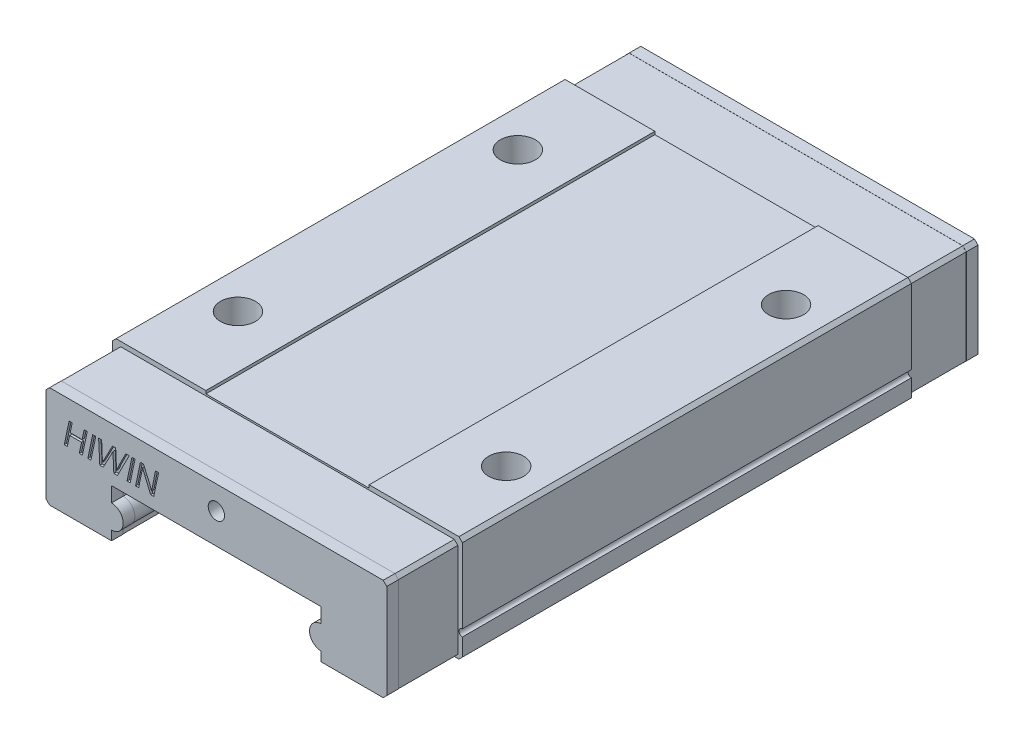
from build123d import *

# Parameters (mm, degrees)
ESBO_O1_W                        = 30
ESBO_O1_H                        = 38.5
RESSALTO_EXTRUS_O1_DEPTH         = 9.1
ESBO_O2_W                        = 14
ESBO_O2_H                        = 0.25
CORTE_EXTRUS_O1_DEPTH            = 44.026154836
ESBO_O3_W                        = 29.2
ESBO_O3_H                        = 8.7
RESSALTO_EXTRUS_O2_DEPTH         = 6.1
ESBO_O4_W                        = 29.2
ESBO_O4_H                        = 8.7
RESSALTO_EXTRUS_O3_DEPTH         = 6.1
CORTE_EXTRUS_O2_DEPTH            = 55.217063735
CORTE_EXTRUS_O3_DEPTH            = 0.2
RESSALTO_EXTRUS_O4_DEPTH         = 0.2
CORTE_EXTRUS_O4_DEPTH            = 0.2
CORTE_EXTRUS_O5_DEPTH            = 0.2
CORTE_EXTRUS_O6_DEPTH            = 0.2
CORTE_EXTRUS_O7_DEPTH            = 0.2
CORTE_EXTRUS_O8_DEPTH            = 0.2
CORTE_EXTRUS_O9_DEPTH            = 0.2
CORTE_EXTRUS_O10_DEPTH           = 0.2
ESBO_O15_W                       = 0.265487361
ESBO_O15_H                       = 1.969960833
CORTE_EXTRUS_O11_DEPTH           = 0.2
ESBO_O16_W                       = 0.266231022
ESBO_O16_H                       = 1.969960833
CORTE_EXTRUS_O12_DEPTH           = 0.2
INCLINA_O1_ANGLE                 = 22.633115591
INCLINA_O2_ANGLE                 = 11.39188109
INCLINA_O3_ANGLE                 = -3.046843479
INCLINA_O4_ANGLE                 = 28.192334499
INCLINA_O5_ANGLE                 = -11.990834979
INCLINA_O6_ANGLE                 = 12.079016479
INCLINA_O7_ANGLE                 = 11.88865804
INCLINA_O8_ANGLE                 = -11.938434882
INCLINA_O9_ANGLE                 = 11.978014058
INCLINA_O10_ANGLE                = -11.998710083
INCLINA_O11_ANGLE                = 11.998710083
INCLINA_O12_ANGLE                = -11.978014058
INCLINA_O13_ANGLE                = 14.581196285
INCLINA_O14_ANGLE                = 14.573026217
INCLINA_O15_ANGLE                = 14.976582162
INCLINA_O16_ANGLE                = -14.766991465
FURO_DE_DI_METRO_1_4_1_4_1_D     = 1.4
FURO_DE_DI_METRO_1_4_1_4_1_DEPTH = 5
FURO_DE_DI_METRO_1_4_1_4_1_TIP   = 0.420602433
FURO_DE_DI_METRO_1_4_1_4_2_D     = 1.4
FURO_DE_DI_METRO_1_4_1_4_2_DEPTH = 5
FURO_DE_DI_METRO_1_4_1_4_2_TIP   = 0.420602433
FURO_DE_DI_METRO_0_6_0_6_1_D     = 0.6
FURO_DE_DI_METRO_3_0_3_1_D       = 3
FURO_DE_DI_METRO_3_0_3_1_DEPTH   = 3
FURO_DE_DI_METRO_3_0_3_1_TIP     = 0.901290929
CHANFRO1_SIZE                    = 0.3
FILETE7_R                        = 0.4
RESSALTO_EXTRUS_O8_START         = -1
RESSALTO_EXTRUS_O8_DEPTH         = 1
RESSALTO_EXTRUS_O9_DEPTH         = 1


with BuildPart() as part:
    # Esboço1 → Ressalto-extrusão1 (new body)
    with BuildSketch(Plane.XZ.offset(-2.9)):
        Rectangle(ESBO_O1_W, ESBO_O1_H)
    extrude(amount=-RESSALTO_EXTRUS_O1_DEPTH)

    # Esboço2 → Corte-extrusão1 (cut, through all)
    with BuildSketch(Plane.XY.offset(19.25)):
        with Locations((0, 11.875)):
            Rectangle(ESBO_O2_W, ESBO_O2_H)
    extrude(amount=-CORTE_EXTRUS_O1_DEPTH, mode=Mode.SUBTRACT)

    # Esboço3 → Ressalto-extrusão2 (add)
    with BuildSketch(Plane(origin=(0, 0, -19.25), x_dir=(-1, 0, 0), z_dir=(0, 0, -1))):
        with Locations((0, 7.25)):
            Rectangle(ESBO_O3_W, ESBO_O3_H)
    extrude(amount=RESSALTO_EXTRUS_O2_DEPTH)

    # Esboço4 → Ressalto-extrusão3 (add)
    with BuildSketch(Plane.XY.offset(19.25)):
        with Locations((0, 7.25)):
            Rectangle(ESBO_O4_W, ESBO_O4_H)
    extrude(amount=RESSALTO_EXTRUS_O3_DEPTH)

    # Esboço5 → Corte-extrusão2 (cut, through all)
    with BuildSketch(Plane.XY.offset(25.35)):
        with BuildLine():
            Line((-9, 2.9), (9, 2.9))
            Line((9, 2.9), (9, 3.7))
            ThreePointArc((9, 3.7), (8, 4.7), (9, 5.7))
            Line((9, 5.7), (9, 7))
            Line((9, 7), (-9, 7))
            Line((-9, 7), (-9, 5.7))
            ThreePointArc((-9, 5.7), (-8, 4.7), (-9, 3.7))
            Line((-9, 3.7), (-9, 2.9))
        make_face()
    extrude(amount=-CORTE_EXTRUS_O2_DEPTH, mode=Mode.SUBTRACT)

    # Esboço6 → Corte-extrusão3 (cut)
    with BuildSketch(Plane(origin=(0, 0, -25.35), x_dir=(-1, 0, 0), z_dir=(0, 0, -1))):
        with BuildLine():
            Line((-7.000151057, 8.44592145), (-7.223791541, 8.430287009))
            add(Edge.make_bspline(
                [(-7.223791541, 8.430287009), (-7.219191725, 8.393318118), (-7.212226655, 8.356510491), (-7.202206849, 8.320629288), (-7.193800871, 8.290527247), (-7.183181512, 8.260912583), (-7.170013247, 8.232568445), (-7.147718227, 8.18457935), (-7.117218551, 8.139342953), (-7.079736622, 8.101991564), (-7.07506839, 8.097339591), (-7.070289483, 8.092796103), (-7.065407855, 8.08836858)],
                knots=[0, 0, 0, 0, 0.000111762, 0.000111762, 0.000111762, 0.000205525, 0.000205525, 0.000205525, 0.000366021, 0.000366021, 0.000366021, 0.000385685, 0.000385685, 0.000385685, 0.000385685], degree=3))
            add(Edge.make_bspline(
                [(-7.065407855, 8.08836858), (-7.028943113, 8.05444789), (-6.985806792, 8.026618159), (-6.939897636, 8.007314273), (-6.894147926, 7.98807743), (-6.844748245, 7.976611018), (-6.795383973, 7.971486488), (-6.720882508, 7.963752452), (-6.643804091, 7.968084429), (-6.571173161, 7.986388298), (-6.504550999, 8.003177884), (-6.440026852, 8.033674479), (-6.384969789, 8.074773414)],
                knots=[0, 0, 0, 0, 0.000149408, 0.000149408, 0.000149408, 0.000297792, 0.000297792, 0.000297792, 0.000522794, 0.000522794, 0.000522794, 0.000729804, 0.000729804, 0.000729804, 0.000729804], degree=3))
            add(Edge.make_bspline(
                [(-6.384969789, 8.074773414), (-6.355205185, 8.096420398), (-6.327621104, 8.121374536), (-6.302932028, 8.148668731), (-6.28049909, 8.173468729), (-6.260251341, 8.200377723), (-6.242270606, 8.228572931), (-6.210688579, 8.278096034), (-6.185721823, 8.332104671), (-6.166087613, 8.387462236)],
                knots=[0, 0, 0, 0, 0.000110412, 0.000110412, 0.000110412, 0.00021058, 0.00021058, 0.00021058, 0.000387215, 0.000387215, 0.000387215, 0.000387215], degree=3))
            add(Edge.make_bspline(
                [(-6.166087613, 8.387462236), (-6.120735052, 8.511715828), (-6.104424369, 8.646152253), (-6.096988169, 8.778214787), (-6.088848603, 8.922768706), (-6.089477381, 9.068822316), (-6.107918975, 9.212425921), (-6.118793707, 9.29710681), (-6.136761323, 9.382507641), (-6.171283235, 9.460593172), (-6.199041917, 9.523380871), (-6.236132155, 9.583322936), (-6.282556522, 9.633895829), (-6.329259846, 9.684772606), (-6.386903718, 9.726949126), (-6.448852587, 9.757477546), (-6.505295364, 9.785292563), (-6.567270431, 9.803747536), (-6.629704565, 9.811585976), (-6.652906702, 9.814498943), (-6.676315223, 9.816039109), (-6.699697885, 9.816314199)],
                knots=[0, 0, 0, 0, 0.000396815, 0.000396815, 0.000396815, 0.000829537, 0.000829537, 0.000829537, 0.001085275, 0.001085275, 0.001085275, 0.00129052, 0.00129052, 0.00129052, 0.001497646, 0.001497646, 0.001497646, 0.001685896, 0.001685896, 0.001685896, 0.001755009, 0.001755009, 0.001755009, 0.001755009], degree=3))
            add(Edge.make_bspline(
                [(-6.699697885, 9.816314199), (-6.762288901, 9.815779233), (-6.825841451, 9.806411956), (-6.885016327, 9.786009617), (-6.94454396, 9.765485654), (-7.000977347, 9.732936593), (-7.048944549, 9.692145422), (-7.092274819, 9.655297486), (-7.130462702, 9.611388484), (-7.160771481, 9.563256783), (-7.194353078, 9.509927699), (-7.218733637, 9.450049261), (-7.233739281, 9.38884023), (-7.254932074, 9.302393407), (-7.259601282, 9.211076374), (-7.251675424, 9.122423295), (-7.245443573, 9.052718196), (-7.229737294, 8.982656566), (-7.201839013, 8.918474615), (-7.178089774, 8.863837825), (-7.144744662, 8.812414098), (-7.104154079, 8.768806647)],
                knots=[0, 0, 0, 0, 0.00018778, 0.00018778, 0.00018778, 0.000377298, 0.000377298, 0.000377298, 0.000547532, 0.000547532, 0.000547532, 0.000736545, 0.000736545, 0.000736545, 0.001004264, 0.001004264, 0.001004264, 0.00121457, 0.00121457, 0.00121457, 0.001393534, 0.001393534, 0.001393534, 0.001393534], degree=3))
            add(Edge.make_bspline(
                [(-7.104154079, 8.768806647), (-7.07888015, 8.741141941), (-7.050906864, 8.715619213), (-7.020527139, 8.693683405), (-6.978268226, 8.663170179), (-6.930257244, 8.639283379), (-6.88024521, 8.624597703), (-6.833599701, 8.610900583), (-6.784339508, 8.604757724), (-6.735725076, 8.604984894), (-6.698436232, 8.605159141), (-6.661147388, 8.605333388), (-6.623858544, 8.605507635), (-6.617999741, 8.605535013), (-6.612140937, 8.60556239), (-6.606282134, 8.605589768)],
                knots=[0, 0, 0, 0, 0.000112414, 0.000112414, 0.000112414, 0.000270113, 0.000270113, 0.000270113, 0.000416688, 0.000416688, 0.000416688, 0.000528023, 0.000528023, 0.000528023, 0.000545516, 0.000545516, 0.000545516, 0.000545516], degree=3))
            add(Edge.make_bspline(
                [(-6.606282134, 8.605589768), (-6.591891073, 8.613757667), (-6.577500011, 8.621925567), (-6.56310895, 8.630093467), (-6.539529834, 8.643476208), (-6.515950718, 8.65685895), (-6.492371601, 8.670241692), (-6.47347319, 8.680967817), (-6.455164235, 8.692827183), (-6.437742508, 8.70581499), (-6.420313542, 8.718808194), (-6.403702988, 8.732988496), (-6.388201036, 8.748229287), (-6.360358039, 8.775603211), (-6.335864761, 8.806785186), (-6.315634441, 8.840181269)],
                knots=[-0.000130736, -0.000130736, -0.000130736, -0.000130736, -8.1186e-05, -8.1186e-05, -8.1186e-05, 0, 0, 0, 6.519e-05, 6.519e-05, 6.519e-05, 0.000130425, 0.000130425, 0.000130425, 0.000248246, 0.000248246, 0.000248246, 0.000248246], degree=3))
            add(Edge.make_bspline(
                [(-6.315634441, 8.840181269), (-6.312042227, 8.788094157), (-6.314629779, 8.73557303), (-6.319595299, 8.683598855), (-6.322132407, 8.657042902), (-6.325599739, 8.630558345), (-6.330016288, 8.604249608), (-6.334455758, 8.577804331), (-6.339860353, 8.55150257), (-6.346223565, 8.525453172)],
                knots=[0, 0, 0, 0, 0.000156633, 0.000156633, 0.000156633, 0.000236517, 0.000236517, 0.000236517, 0.000316819, 0.000316819, 0.000316819, 0.000316819], degree=3))
            add(Edge.make_bspline(
                [(-6.346223565, 8.525453172), (-6.351493253, 8.503014502), (-6.357243085, 8.480677945), (-6.363666213, 8.458541844), (-6.370091459, 8.436398442), (-6.377193164, 8.414427216), (-6.385279743, 8.392835057), (-6.395320538, 8.366024901), (-6.406899221, 8.339645064), (-6.420996979, 8.314728097)],
                knots=[0, 0, 0, 0, 6.9147e-05, 6.9147e-05, 6.9147e-05, 0.000138335, 0.000138335, 0.000138335, 0.000224386, 0.000224386, 0.000224386, 0.000224386], degree=3))
            add(Edge.make_bspline(
                [(-6.420996979, 8.314728097), (-6.427997096, 8.301410801), (-6.435910039, 8.288529598), (-6.444686248, 8.276309526), (-6.453464947, 8.264085986), (-6.463152217, 8.252464964), (-6.473613092, 8.241645974), (-6.493364076, 8.221218838), (-6.516184683, 8.20344964), (-6.540634441, 8.18897281)],
                knots=[0, 0, 0, 0, 4.5135e-05, 4.5135e-05, 4.5135e-05, 9.029e-05, 9.029e-05, 9.029e-05, 0.000176113, 0.000176113, 0.000176113, 0.000176113], degree=3))
            add(Edge.make_bspline(
                [(-6.540634441, 8.18897281), (-6.554704053, 8.180271865), (-6.569523794, 8.172671538), (-6.584830419, 8.166397173), (-6.600139663, 8.160121735), (-6.616034719, 8.155132928), (-6.632170756, 8.151474733), (-6.659551424, 8.145267272), (-6.687942553, 8.14285025), (-6.716012085, 8.143429003)],
                knots=[0, 0, 0, 0, 4.9628e-05, 4.9628e-05, 4.9628e-05, 9.9266e-05, 9.9266e-05, 9.9266e-05, 0.000183894, 0.000183894, 0.000183894, 0.000183894], degree=3))
            add(Edge.make_bspline(
                [(-6.716012085, 8.143429003), (-6.74586282, 8.142891152), (-6.776289873, 8.146453445), (-6.804776565, 8.155390117), (-6.833465022, 8.164390086), (-6.860841789, 8.179286579), (-6.884085717, 8.198358727), (-6.904553743, 8.215153188), (-6.922387151, 8.235619414), (-6.936572159, 8.257975165), (-6.958776521, 8.292969518), (-6.973702306, 8.332683702), (-6.984518098, 8.372691915), (-6.991031902, 8.396786837), (-6.996098244, 8.421292816), (-7.000151057, 8.44592145)],
                knots=[0, 0, 0, 0, 8.9567e-05, 8.9567e-05, 8.9567e-05, 0.00018014, 0.00018014, 0.00018014, 0.000259489, 0.000259489, 0.000259489, 0.000383963, 0.000383963, 0.000383963, 0.000458384, 0.000458384, 0.000458384, 0.000458384], degree=3))
        make_face()
    extrude(amount=-CORTE_EXTRUS_O3_DEPTH, mode=Mode.SUBTRACT)

    # Esboço7 → Ressalto-extrusão4 (add)
    with BuildSketch(Plane(origin=(0, 0, -25.15), x_dir=(-1, 0, 0), z_dir=(0, 0, -1))):
        with BuildLine():
            add(Edge.make_bspline(
                [(-6.429154079, 8.919712991), (-6.445649499, 8.901133938), (-6.464164385, 8.884101169), (-6.484376522, 8.869653), (-6.511453264, 8.850297829), (-6.542241571, 8.835369923), (-6.574179105, 8.826001545), (-6.607657093, 8.8161813), (-6.643057817, 8.812078593), (-6.677945619, 8.812311178)],
                knots=[0, 0, 0, 0, 7.4535e-05, 7.4535e-05, 7.4535e-05, 0.000175135, 0.000175135, 0.000175135, 0.000280366, 0.000280366, 0.000280366, 0.000280366], degree=3))
            add(Edge.make_bspline(
                [(-6.677945619, 8.812311178), (-6.703658085, 8.812145291), (-6.72953306, 8.814136773), (-6.754804126, 8.818883525), (-6.79045191, 8.825579371), (-6.825606492, 8.838186616), (-6.856898719, 8.8565277), (-6.885462268, 8.873269445), (-6.91142463, 8.895069427), (-6.933534743, 8.919712991), (-6.950633932, 8.938771462), (-6.967733122, 8.957829933), (-6.984832311, 8.976888405), (-7.053229067, 9.05312229), (-7.121625824, 9.129356175), (-7.190022581, 9.20559006), (-7.192042787, 9.207841748), (-7.194062994, 9.210093437), (-7.1960832, 9.212345125)],
                knots=[0, 0, 0, 0, 7.7139e-05, 7.7139e-05, 7.7139e-05, 0.000186943, 0.000186943, 0.000186943, 0.000286874, 0.000286874, 0.000286874, 0.000363289, 0.000363289, 0.000363289, 0.000668949, 0.000668949, 0.000668949, 0.000677977, 0.000677977, 0.000677977, 0.000677977], degree=3))
            add(Edge.make_bspline(
                [(-7.1960832, 9.212345125), (-7.176996051, 9.234211957), (-7.157908902, 9.256078788), (-7.138821752, 9.277945619), (-7.103814199, 9.31805136), (-7.068806647, 9.3581571), (-7.033799094, 9.39826284), (-7.016295317, 9.41831571), (-6.998791541, 9.43836858), (-6.981287764, 9.45842145), (-6.963783988, 9.47847432), (-6.946280211, 9.49852719), (-6.928776435, 9.51858006), (-6.911331635, 9.538565366), (-6.892017349, 9.557136422), (-6.870951634, 9.573259982), (-6.84167926, 9.595664865), (-6.808239884, 9.613581139), (-6.773153111, 9.624884637), (-6.740604182, 9.635370547), (-6.706021058, 9.640480646), (-6.671827795, 9.640936556)],
                knots=[-0.000404628, -0.000404628, -0.000404628, -0.000404628, -0.00031795, -0.00031795, -0.00031795, -0.000158975, -0.000158975, -0.000158975, -7.9487e-05, -7.9487e-05, -7.9487e-05, 0, 0, 0, 7.9584e-05, 7.9584e-05, 7.9584e-05, 0.000191135, 0.000191135, 0.000191135, 0.000294284, 0.000294284, 0.000294284, 0.000294284], degree=3))
            add(Edge.make_bspline(
                [(-6.671827795, 9.640936556), (-6.634717837, 9.6404282), (-6.597066459, 9.634663135), (-6.562044874, 9.622379163), (-6.526811841, 9.610021025), (-6.493435775, 9.590542518), (-6.465169585, 9.566147586), (-6.439778845, 9.544234289), (-6.417622806, 9.518128719), (-6.399533698, 9.489885731), (-6.378524113, 9.457082926), (-6.362744341, 9.420567868), (-6.352015251, 9.383120395), (-6.334703247, 9.322696743), (-6.329533376, 9.258469595), (-6.33171, 9.195652515), (-6.333588643, 9.141435134), (-6.341715285, 9.086418333), (-6.360205894, 9.035416852), (-6.375508462, 8.993208745), (-6.398844739, 8.952834537), (-6.429154079, 8.919712991)],
                knots=[0, 0, 0, 0, 0.00011134, 0.00011134, 0.00011134, 0.000223733, 0.000223733, 0.000223733, 0.000324047, 0.000324047, 0.000324047, 0.000440727, 0.000440727, 0.000440727, 0.000629926, 0.000629926, 0.000629926, 0.000793196, 0.000793196, 0.000793196, 0.000928756, 0.000928756, 0.000928756, 0.000928756], degree=3))
        make_face()
    extrude(amount=RESSALTO_EXTRUS_O4_DEPTH)

    # Esboço8 → Corte-extrusão4 (cut)
    with BuildSketch(Plane.XY.offset(25.35)):
        with BuildLine():
            Line((-10.100248038, 8), (-9.704619815, 8))
            Line((-9.704619815, 8), (-9.704619815, 8.029090311))
            add(Edge.make_bspline(
                [(-8.871718292, 9.586231203), (-8.885848206, 9.554067057), (-8.900169593, 9.521985598), (-8.914771239, 9.49003284), (-8.930187987, 9.456296397), (-8.945910564, 9.422695025), (-8.962153982, 9.389348734), (-8.97841324, 9.355969923), (-8.995161603, 9.322808226), (-9.013014086, 9.290253698), (-9.132581023, 9.072219873), (-9.252147959, 8.854186048), (-9.371714895, 8.636152223), (-9.482683202, 8.433798252), (-9.593651508, 8.231444281), (-9.704619815, 8.029090311)],
                knots=[0, 0, 0, 0, 0.000105393, 0.000105393, 0.000105393, 0.000216673, 0.000216673, 0.000216673, 0.000328076, 0.000328076, 0.000328076, 0.001073914, 0.001073914, 0.001073914, 0.001766116, 0.001766116, 0.001766116, 0.001766116], degree=3))
            add(Edge.make_bspline(
                [(-8.792890112, 8), (-8.801892928, 8.200812798), (-8.810895743, 8.401625596), (-8.819898559, 8.602438395), (-8.827252018, 8.766461389), (-8.834605477, 8.930484384), (-8.841958936, 9.094507379), (-8.849313296, 9.258550449), (-8.858143985, 9.422585386), (-8.871718292, 9.586231203)],
                knots=[0, 0, 0, 0, 0.000603044, 0.000603044, 0.000603044, 0.001095607, 0.001095607, 0.001095607, 0.001588291, 0.001588291, 0.001588291, 0.001588291], degree=3))
            Line((-8.792890112, 8), (-8.480552041, 8))
            Line((-8.480552041, 8), (-7.477351904, 9.969960833))
            Line((-7.477351904, 9.969960833), (-7.770354761, 9.969960833))
            Line((-7.770354761, 9.969960833), (-8.330332303, 8.86413533))
            add(Edge.make_bspline(
                [(-8.466422462, 8.547335286), (-8.451177325, 8.5839608), (-8.435835688, 8.620546403), (-8.420366304, 8.657077768), (-8.405693274, 8.691728523), (-8.390908054, 8.726332278), (-8.375946637, 8.760859493), (-8.36098357, 8.795390518), (-8.345875149, 8.82986136), (-8.330332303, 8.86413533)],
                knots=[0, 0, 0, 0, 0.000119015, 0.000119015, 0.000119015, 0.000231904, 0.000231904, 0.000231904, 0.000344806, 0.000344806, 0.000344806, 0.000344806], degree=3))
            add(Edge.make_bspline(
                [(-8.557892897, 8.331673285), (-8.548408813, 8.356569007), (-8.538229016, 8.381198088), (-8.527893932, 8.405752739), (-8.517914517, 8.429462372), (-8.507736628, 8.453088573), (-8.497469362, 8.476674982), (-8.487201088, 8.500263707), (-8.476837749, 8.523811103), (-8.466422462, 8.547335286)],
                knots=[0, 0, 0, 0, 7.9923e-05, 7.9923e-05, 7.9923e-05, 0.00015709, 0.00015709, 0.00015709, 0.000234265, 0.000234265, 0.000234265, 0.000234265], degree=3))
            add(Edge.make_bspline(
                [(-8.635977415, 9.969960833), (-8.62802662, 9.783358092), (-8.620075826, 9.59675535), (-8.612125031, 9.410152608), (-8.604463865, 9.23034736), (-8.596802699, 9.050542113), (-8.589141532, 8.870736865), (-8.581479467, 8.690910512), (-8.569772856, 8.511270309), (-8.557892897, 8.331673285)],
                knots=[0, 0, 0, 0, 0.000560316, 0.000560316, 0.000560316, 0.001100221, 0.001100221, 0.001100221, 0.001640253, 0.001640253, 0.001640253, 0.001640253], degree=3))
            Line((-8.635977415, 9.969960833), (-8.907414072, 9.969960833))
            add(Edge.make_bspline(
                [(-9.760394471, 8.348777513), (-9.624934832, 8.622335613), (-9.485275366, 8.893858508), (-9.341280653, 9.163021786), (-9.269251534, 9.297662797), (-9.196846796, 9.432102667), (-9.124418564, 9.566529401), (-9.051990279, 9.700956234), (-8.979538163, 9.835370546), (-8.907414072, 9.969960833)],
                knots=[0, 0, 0, 0, 0.000915778, 0.000915778, 0.000915778, 0.001373813, 0.001373813, 0.001373813, 0.001831847, 0.001831847, 0.001831847, 0.001831847], degree=3))
            add(Edge.make_bspline(
                [(-9.775267712, 8.494535279), (-9.774808727, 8.484437605), (-9.773751244, 8.47437444), (-9.77277419, 8.464313673), (-9.770902282, 8.445038567), (-9.768833436, 8.42578286), (-9.766747016, 8.406529793), (-9.764660481, 8.387275651), (-9.762533183, 8.368025929), (-9.760394471, 8.348777513)],
                knots=[0, 0, 0, 0, 3.0324e-05, 3.0324e-05, 3.0324e-05, 8.8417e-05, 8.8417e-05, 8.8417e-05, 0.000146513, 0.000146513, 0.000146513, 0.000146513], degree=3))
            add(Edge.make_bspline(
                [(-9.781217009, 8.615752197), (-9.780287429, 8.601064843), (-9.779374513, 8.586376356), (-9.778513917, 8.571684799), (-9.777761427, 8.558838787), (-9.777044476, 8.545990279), (-9.776439621, 8.533136469), (-9.775834532, 8.520277706), (-9.775267712, 8.507408271), (-9.775267712, 8.494535279)],
                knots=[0, 0, 0, 0, 4.415e-05, 4.415e-05, 4.415e-05, 8.2755e-05, 8.2755e-05, 8.2755e-05, 0.000121378, 0.000121378, 0.000121378, 0.000121378], degree=3))
            add(Edge.make_bspline(
                [(-9.838478988, 9.969960833), (-9.833744529, 9.857108546), (-9.82901007, 9.744256258), (-9.824275611, 9.631403971), (-9.819541152, 9.518551683), (-9.814806693, 9.405699396), (-9.810072234, 9.292847108), (-9.800603314, 9.067142483), (-9.791065229, 8.84144059), (-9.781217009, 8.615752197)],
                knots=[0, 0, 0, 0, 0.000338855, 0.000338855, 0.000338855, 0.000677709, 0.000677709, 0.000677709, 0.001355419, 0.001355419, 0.001355419, 0.001355419], degree=3))
            Line((-9.838478988, 9.969960833), (-10.100248038, 9.969960833))
            Line((-10.100248038, 9.969960833), (-10.100248038, 8))
        make_face()
    extrude(amount=-CORTE_EXTRUS_O4_DEPTH, mode=Mode.SUBTRACT)

    # Esboço9 → Corte-extrusão5 (cut)
    with BuildSketch(Plane(origin=(0, 0, -25.35), x_dir=(-1, 0, 0), z_dir=(0, 0, -1))):
        with BuildLine():
            Line((-9.884365559, 8.250830816), (-9.884365559, 8.923791541))
            Line((-9.884365559, 8.923791541), (-10.632779456, 8.923791541))
            Line((-10.632779456, 8.923791541), (-10.632779456, 8.716465257))
            Line((-10.632779456, 8.716465257), (-10.122960725, 8.716465257))
            Line((-10.122960725, 8.716465257), (-10.122960725, 8.368429003))
            add(Edge.make_bspline(
                [(-10.122960725, 8.368429003), (-10.142057077, 8.349855839), (-10.163315379, 8.333436511), (-10.185437135, 8.318595318), (-10.207490611, 8.303799933), (-10.230558497, 8.290479033), (-10.254098034, 8.278184748), (-10.283787503, 8.262678462), (-10.314323307, 8.248758793), (-10.345241692, 8.235876133)],
                knots=[0, 0, 0, 0, 7.9917e-05, 7.9917e-05, 7.9917e-05, 0.000159455, 0.000159455, 0.000159455, 0.000259754, 0.000259754, 0.000259754, 0.000259754], degree=3))
            add(Edge.make_bspline(
                [(-10.345241692, 8.235876133), (-10.369576993, 8.225325163), (-10.394497911, 8.216026051), (-10.419816947, 8.208121859), (-10.445138873, 8.200216765), (-10.470932457, 8.193685112), (-10.496970335, 8.188613685), (-10.54582311, 8.179098576), (-10.595928445, 8.174718486), (-10.645694864, 8.175377644)],
                knots=[0, 0, 0, 0, 7.9572e-05, 7.9572e-05, 7.9572e-05, 0.000159159, 0.000159159, 0.000159159, 0.000309057, 0.000309057, 0.000309057, 0.000309057], degree=3))
            add(Edge.make_bspline(
                [(-10.645694864, 8.175377644), (-10.732807747, 8.174370558), (-10.82147441, 8.189758939), (-10.903246664, 8.219808348), (-10.964104261, 8.242172104), (-11.023616062, 8.272050598), (-11.074172017, 8.312644688), (-11.125097112, 8.35353518), (-11.168158294, 8.405470149), (-11.201245552, 8.461778505), (-11.239359937, 8.526642095), (-11.265306697, 8.59938105), (-11.280742006, 8.673013534), (-11.306121342, 8.794082933), (-11.309649121, 8.921439362), (-11.292407676, 9.043932801), (-11.281817964, 9.119168394), (-11.262290746, 9.193691268), (-11.234365559, 9.264350453)],
                knots=[0, 0, 0, 0, 0.000261356, 0.000261356, 0.000261356, 0.000454717, 0.000454717, 0.000454717, 0.000649837, 0.000649837, 0.000649837, 0.000874481, 0.000874481, 0.000874481, 0.00124519, 0.00124519, 0.00124519, 0.00147111, 0.00147111, 0.00147111, 0.00147111], degree=3))
            add(Edge.make_bspline(
                [(-11.234365559, 9.264350453), (-11.227137339, 9.28092247), (-11.219224939, 9.297212077), (-11.210676301, 9.313143169), (-11.202127888, 9.329073842), (-11.192929597, 9.34467175), (-11.183138404, 9.359870245), (-11.164465582, 9.38885535), (-11.143550589, 9.416498938), (-11.120845921, 9.44244713)],
                knots=[0, 0, 0, 0, 5.4239e-05, 5.4239e-05, 5.4239e-05, 0.000108476, 0.000108476, 0.000108476, 0.000212113, 0.000212113, 0.000212113, 0.000212113], degree=3))
            add(Edge.make_bspline(
                [(-11.120845921, 9.44244713), (-11.106457236, 9.458234715), (-11.090915614, 9.473030948), (-11.07452868, 9.486733155), (-11.058149292, 9.500429051), (-11.040861411, 9.513091055), (-11.02295105, 9.524713486), (-10.993449414, 9.543857753), (-10.962086156, 9.560297494), (-10.929833837, 9.574320242)],
                knots=[0, 0, 0, 0, 6.4082e-05, 6.4082e-05, 6.4082e-05, 0.000128115, 0.000128115, 0.000128115, 0.000233796, 0.000233796, 0.000233796, 0.000233796], degree=3))
            add(Edge.make_bspline(
                [(-10.929833837, 9.574320242), (-10.904803305, 9.584677703), (-10.878945193, 9.593170294), (-10.852731808, 9.600001328), (-10.826539339, 9.606826911), (-10.799887774, 9.61202761), (-10.773091775, 9.615849711), (-10.732070946, 9.6217008), (-10.690528855, 9.624361758), (-10.649093656, 9.624622356), (-10.60371869, 9.624907734), (-10.558343725, 9.625193111), (-10.512968759, 9.625478488)],
                knots=[0, 0, 0, 0, 8.1266e-05, 8.1266e-05, 8.1266e-05, 0.000162427, 0.000162427, 0.000162427, 0.000286799, 0.000286799, 0.000286799, 0.000422716, 0.000422716, 0.000422716, 0.000422716], degree=3))
            add(Edge.make_bspline(
                [(-10.512968759, 9.625478488), (-10.498808226, 9.619316034), (-10.484647693, 9.61315358), (-10.47048716, 9.606991125), (-10.447545317, 9.597007175), (-10.424603474, 9.587023225), (-10.401661631, 9.577039275), (-10.383284521, 9.569041829), (-10.365247022, 9.560176717), (-10.347817659, 9.550282546), (-10.330374166, 9.540380354), (-10.313476795, 9.5294045), (-10.297518791, 9.517252507), (-10.273063858, 9.498630119), (-10.250571359, 9.476923965), (-10.231722054, 9.452643505)],
                knots=[-0.000121234, -0.000121234, -0.000121234, -0.000121234, -7.4964e-05, -7.4964e-05, -7.4964e-05, 0, 0, 0, 6.0126e-05, 6.0126e-05, 6.0126e-05, 0.000120335, 0.000120335, 0.000120335, 0.000213108, 0.000213108, 0.000213108, 0.000213108], degree=3))
            add(Edge.make_bspline(
                [(-10.231722054, 9.452643505), (-10.217568945, 9.433932614), (-10.204984845, 9.413981046), (-10.193727249, 9.393397691), (-10.182485265, 9.372842884), (-10.172510815, 9.351568088), (-10.163548177, 9.329921993), (-10.15129129, 9.300319801), (-10.140875814, 9.269925717), (-10.131797583, 9.239199396)],
                knots=[0, 0, 0, 0, 7.0382e-05, 7.0382e-05, 7.0382e-05, 0.000140609, 0.000140609, 0.000140609, 0.000236671, 0.000236671, 0.000236671, 0.000236671], degree=3))
            Line((-10.131797583, 9.239199396), (-9.91223565, 9.296978852))
            add(Edge.make_bspline(
                [(-9.91223565, 9.296978852), (-9.936133408, 9.391507763), (-9.971661325, 9.485965916), (-10.027781027, 9.565699202), (-10.064171604, 9.617401904), (-10.110875549, 9.66290461), (-10.162942723, 9.698771764), (-10.227141909, 9.742996214), (-10.300622655, 9.774773477), (-10.375615578, 9.796066642), (-10.462763625, 9.820811079), (-10.554423471, 9.831474339), (-10.645015106, 9.83194864)],
                knots=[0, 0, 0, 0, 0.000292509, 0.000292509, 0.000292509, 0.000481171, 0.000481171, 0.000481171, 0.000713784, 0.000713784, 0.000713784, 0.000983769, 0.000983769, 0.000983769, 0.000983769], degree=3))
            add(Edge.make_bspline(
                [(-10.645015106, 9.83194864), (-10.689606076, 9.831778446), (-10.734269702, 9.829294321), (-10.778559676, 9.82411921), (-10.822873059, 9.818941363), (-10.86697449, 9.811040119), (-10.910242365, 9.800159999), (-10.982213764, 9.782062103), (-11.052610038, 9.755324533), (-11.118126888, 9.720468278)],
                knots=[0, 0, 0, 0, 0.000133774, 0.000133774, 0.000133774, 0.000267666, 0.000267666, 0.000267666, 0.000491494, 0.000491494, 0.000491494, 0.000491494], degree=3))
            add(Edge.make_bspline(
                [(-11.118126888, 9.720468278), (-11.189850227, 9.681020442), (-11.255694222, 9.628387326), (-11.309808009, 9.566970169), (-11.363783173, 9.505710345), (-11.407286549, 9.434492305), (-11.441017404, 9.360139674), (-11.492389644, 9.246900292), (-11.524829927, 9.123250956), (-11.536081251, 8.999413674), (-11.547380393, 8.875050095), (-11.540056453, 8.747063128), (-11.510930753, 8.625631402), (-11.48785331, 8.52941625), (-11.45017561, 8.435159874), (-11.397855685, 8.351180417), (-11.353395706, 8.279817071), (-11.296392606, 8.214795303), (-11.23080596, 8.162185336), (-11.165309585, 8.109647778), (-11.090077923, 8.068220738), (-11.011931177, 8.037511516), (-10.925052625, 8.003370968), (-10.832252404, 7.982316493), (-10.739334916, 7.973383381), (-10.627411293, 7.962623015), (-10.51250179, 7.967877896), (-10.402479833, 7.991069532), (-10.2801878, 8.01684759), (-10.161448348, 8.065833675), (-10.054297056, 8.130164461), (-9.994735222, 8.165923803), (-9.937965852, 8.206634083), (-9.884365559, 8.250830816)],
                knots=[0, 0, 0, 0, 0.000245567, 0.000245567, 0.000245567, 0.000489839, 0.000489839, 0.000489839, 0.000863531, 0.000863531, 0.000863531, 0.00123824, 0.00123824, 0.00123824, 0.001534517, 0.001534517, 0.001534517, 0.001786298, 0.001786298, 0.001786298, 0.002037206, 0.002037206, 0.002037206, 0.00231615, 0.00231615, 0.00231615, 0.002652781, 0.002652781, 0.002652781, 0.003028008, 0.003028008, 0.003028008, 0.003234507, 0.003234507, 0.003234507, 0.003234507], degree=3))
        make_face()
    extrude(amount=-CORTE_EXTRUS_O5_DEPTH, mode=Mode.SUBTRACT)

    # Esboço10 → Corte-extrusão6 (cut)
    with BuildSketch(Plane(origin=(0, 0, -25.35), x_dir=(-1, 0, 0), z_dir=(0, 0, -1))):
        with BuildLine():
            Line((-9.201888218, 8), (-8.934063444, 8))
            Line((-8.934063444, 8), (-8.934063444, 8.052518718))
            add(Edge.make_bspline(
                [(-8.934063444, 8.052518718), (-8.871947575, 8.282077365), (-8.809831706, 8.511636012), (-8.747715836, 8.74119466), (-8.719861384, 8.844135026), (-8.692006932, 8.947075392), (-8.66415248, 9.050015759), (-8.650225254, 9.101485942), (-8.636298028, 9.152956125), (-8.622370802, 9.204426308), (-8.608443576, 9.255896492), (-8.59451635, 9.307366675), (-8.580589124, 9.358836858), (-8.574441608, 9.381555939), (-8.568431107, 9.404312053), (-8.562459465, 9.427077994), (-8.556487881, 9.449843715), (-8.550559349, 9.472620715), (-8.544633164, 9.495398296), (-8.537139638, 9.524200026), (-8.529650881, 9.553003008), (-8.522129909, 9.581797583)],
                knots=[-0.001353282, -0.001353282, -0.001353282, -0.001353282, -0.000639847, -0.000639847, -0.000639847, -0.000319924, -0.000319924, -0.000319924, -0.000159962, -0.000159962, -0.000159962, 0, 0, 0, 7.0608e-05, 7.0608e-05, 7.0608e-05, 0.000141216, 0.000141216, 0.000141216, 0.000230497, 0.000230497, 0.000230497, 0.000230497], degree=3))
            add(Edge.make_bspline(
                [(-8.522129909, 9.581797583), (-8.480764781, 9.440466728), (-8.4482486, 9.296694941), (-8.411169158, 9.154179681), (-8.374107353, 9.011732207), (-8.337045547, 8.869284734), (-8.299983742, 8.72683726), (-8.236947872, 8.484558174), (-8.173912003, 8.242279087), (-8.110876133, 8)],
                knots=[0, 0, 0, 0, 0.00044178, 0.00044178, 0.00044178, 0.000883349, 0.000883349, 0.000883349, 0.001634384, 0.001634384, 0.001634384, 0.001634384], degree=3))
            Line((-8.110876133, 8), (-7.367220544, 8))
            Line((-7.367220544, 8), (-7.367220544, 9.8))
            Line((-7.367220544, 9.8), (-7.614652568, 9.8))
            add(Edge.make_bspline(
                [(-7.614652568, 9.8), (-7.646300791, 9.665983451), (-7.677998431, 9.531978575), (-7.709694359, 9.397973301), (-7.741390287, 9.263968029), (-7.773084505, 9.129962346), (-7.804725883, 8.995944183), (-7.863360756, 8.747594132), (-7.920692128, 8.498934097), (-7.980362538, 8.250830816)],
                knots=[0, 0, 0, 0, 0.000413108, 0.000413108, 0.000413108, 0.000826216, 0.000826216, 0.000826216, 0.00159175, 0.00159175, 0.00159175, 0.00159175], degree=3))
            add(Edge.make_bspline(
                [(-7.980362538, 8.250830816), (-7.988508196, 8.309042468), (-7.998146051, 8.367060425), (-8.009088412, 8.424811727), (-8.020030069, 8.482559315), (-8.032282064, 8.540070785), (-8.045687927, 8.597296536), (-8.068556399, 8.694915423), (-8.094795386, 8.791787077), (-8.123791541, 8.88776435), (-8.157779456, 9.00026435), (-8.191767372, 9.11276435), (-8.225755287, 9.22526435), (-8.273111782, 9.38201435), (-8.320468278, 9.53876435), (-8.367824773, 9.69551435)],
                knots=[0, 0, 0, 0, 0.000176336, 0.000176336, 0.000176336, 0.000352654, 0.000352654, 0.000352654, 0.00065352, 0.00065352, 0.00065352, 0.001006015, 0.001006015, 0.001006015, 0.001497157, 0.001497157, 0.001497157, 0.001497157], degree=3))
            Line((-8.367824773, 9.69551435), (-8.367824773, 9.8))
            Line((-8.367824773, 9.8), (-8.677114804, 9.8))
            Line((-8.677114804, 9.8), (-8.677114804, 9.742673716))
            add(Edge.make_bspline(
                [(-8.677114804, 9.742673716), (-8.715067976, 9.603512085), (-8.753021148, 9.464350453), (-8.79097432, 9.325188822), (-8.825132175, 9.199943353), (-8.85929003, 9.074697885), (-8.893447885, 8.949452417), (-8.92760574, 8.824206949), (-8.961763595, 8.69896148), (-8.99592145, 8.573716012), (-9.002200986, 8.550691047), (-9.008117394, 8.527568423), (-9.0141137, 8.504468079), (-9.025082329, 8.462212207), (-9.035980008, 8.419937937), (-9.046874453, 8.377662878), (-9.057768911, 8.335387766), (-9.068651175, 8.293109511), (-9.079531722, 8.250830816)],
                knots=[-0.001211599, -0.001211599, -0.001211599, -0.001211599, -0.000778885, -0.000778885, -0.000778885, -0.000389442, -0.000389442, -0.000389442, 0, 0, 0, 7.1598e-05, 7.1598e-05, 7.1598e-05, 0.000202566, 0.000202566, 0.000202566, 0.000333535, 0.000333535, 0.000333535, 0.000333535], degree=3))
            add(Edge.make_bspline(
                [(-9.079531722, 8.250830816), (-9.11057878, 8.38007322), (-9.141288555, 8.509396736), (-9.171823602, 8.638761067), (-9.202358575, 8.768125087), (-9.232893548, 8.897489107), (-9.263428521, 9.026853126), (-9.324259497, 9.284568751), (-9.385090474, 9.542284375), (-9.44592145, 9.8)],
                knots=[0, 0, 0, 0, 0.000398758, 0.000398758, 0.000398758, 0.000797514, 0.000797514, 0.000797514, 0.001591905, 0.001591905, 0.001591905, 0.001591905], degree=3))
            Line((-9.44592145, 9.8), (-9.692673716, 9.8))
            Line((-9.692673716, 9.8), (-9.201888218, 8))
        make_face()
    extrude(amount=-CORTE_EXTRUS_O6_DEPTH, mode=Mode.SUBTRACT)

    # Esboço11 → Corte-extrusão7 (cut)
    with BuildSketch(Plane(origin=(0, 0, -25.35), x_dir=(-1, 0, 0), z_dir=(0, 0, -1))):
        with BuildLine():
            Line((-13.612160121, 8), (-13.372885196, 8))
            Line((-13.372885196, 8), (-13.372885196, 9.529456193))
            Line((-13.372885196, 9.529456193), (-12.857628399, 8))
            Line((-12.857628399, 8), (-12.632628399, 8))
            Line((-12.632628399, 8), (-12.114652568, 9.529456193))
            Line((-12.114652568, 9.529456193), (-12.114652568, 8))
            Line((-12.114652568, 8), (-11.875377644, 8))
            Line((-11.875377644, 8), (-11.875377644, 9.8))
            Line((-11.875377644, 9.8), (-12.20641994, 9.8))
            add(Edge.make_bspline(
                [(-12.20641994, 9.8), (-12.252858531, 9.664381565), (-12.299516243, 9.528838225), (-12.346178501, 9.393296584), (-12.392840737, 9.257755007), (-12.439507598, 9.122214903), (-12.485964529, 8.986602821), (-12.568028611, 8.74705017), (-12.653145503, 8.508431172), (-12.727794562, 8.266465257)],
                knots=[0, 0, 0, 0, 0.000430047, 0.000430047, 0.000430047, 0.000860093, 0.000860093, 0.000860093, 0.001619764, 0.001619764, 0.001619764, 0.001619764], degree=3))
            add(Edge.make_bspline(
                [(-12.727794562, 8.266465257), (-12.73732875, 8.296480292), (-12.747273964, 8.326363722), (-12.757216743, 8.356245894), (-12.76693832, 8.385463265), (-12.776700267, 8.414667191), (-12.786425987, 8.443883183), (-12.796151713, 8.473099193), (-12.805845763, 8.502325805), (-12.815483384, 8.531570997)],
                knots=[0, 0, 0, 0, 9.4479e-05, 9.4479e-05, 9.4479e-05, 0.000186855, 0.000186855, 0.000186855, 0.000279231, 0.000279231, 0.000279231, 0.000279231], degree=3))
            Line((-12.815483384, 8.531570997), (-13.248489426, 9.8))
            Line((-13.248489426, 9.8), (-13.612160121, 9.8))
            Line((-13.612160121, 9.8), (-13.612160121, 8))
        make_face()
    extrude(amount=-CORTE_EXTRUS_O7_DEPTH, mode=Mode.SUBTRACT)

    # Esboço12 → Corte-extrusão8 (cut)
    with BuildSketch(Plane(origin=(0, 0, -25.35), x_dir=(-1, 0, 0), z_dir=(0, 0, -1))):
        Polygon((-5.534592145, 9.051586103), (-5.534592145, 9.8), (-5.773867069, 9.8), (-5.773867069, 8), (-5.534592145, 8), (-5.534592145, 8.844259819), (-4.626435045, 8.844259819), (-4.626435045, 8), (-4.387839879, 8), (-4.387839879, 9.8), (-4.626435045, 9.8), (-4.626435045, 9.051586103), align=None)
    extrude(amount=-CORTE_EXTRUS_O8_DEPTH, mode=Mode.SUBTRACT)

    # Esboço13 → Corte-extrusão9 (cut)
    with BuildSketch(Plane.XY.offset(25.35)):
        Polygon((-12.534997668, 9.150445228), (-12.534997668, 9.969960833), (-12.627211765, 9.969960833), (-13.045893513, 8), (-12.582592041, 8), (-12.582592041, 8.924371958), (-11.560056689, 8.924371958), (-11.560056689, 8), (-11.490152454, 8), (-11.072214369, 9.969960833), (-11.339189053, 9.969960833), (-11.339189053, 9.150445228), align=None)
    extrude(amount=-CORTE_EXTRUS_O9_DEPTH, mode=Mode.SUBTRACT)

    # Esboço14 → Corte-extrusão10 (cut)
    with BuildSketch(Plane.XY.offset(25.35)):
        with BuildLine():
            Line((-6.259233427, 9.969960833), (-6.509847546, 9.969960833))
            Line((-6.509847546, 9.969960833), (-6.927785631, 8))
            Line((-6.927785631, 8), (-6.662298271, 8))
            Line((-6.662298271, 8), (-6.662298271, 8.325177178))
            add(Edge.make_bspline(
                [(-6.331368648, 9.644236845), (-6.335390634, 9.596901169), (-6.342123075, 9.54977808), (-6.35030592, 9.502981888), (-6.359239189, 9.451894164), (-6.369972076, 9.401109441), (-6.38182724, 9.3506197), (-6.393713009, 9.299999614), (-6.406754535, 9.249644222), (-6.420608097, 9.199526925), (-6.445892608, 9.10805649), (-6.471177118, 9.016586055), (-6.496461629, 8.92511562), (-6.551740509, 8.725136139), (-6.60701939, 8.525156659), (-6.662298271, 8.325177178)],
                knots=[0, 0, 0, 0, 0.000142519, 0.000142519, 0.000142519, 0.000298058, 0.000298058, 0.000298058, 0.000453977, 0.000453977, 0.000453977, 0.0007385, 0.0007385, 0.0007385, 0.001360546, 0.001360546, 0.001360546, 0.001360546], degree=3))
            add(Edge.make_bspline(
                [(-5.644968554, 8.152157945), (-5.70917138, 8.285618937), (-5.773374205, 8.419079929), (-5.837577031, 8.552540921), (-5.884799573, 8.650704315), (-5.932022115, 8.748867708), (-5.979244656, 8.847031102), (-6.026467198, 8.945194496), (-6.07368974, 9.04335789), (-6.120912281, 9.141521283), (-6.144525317, 9.190606649), (-6.167590116, 9.239961791), (-6.189945765, 9.289632441), (-6.212302538, 9.33930559), (-6.233959718, 9.389304281), (-6.254651307, 9.439693815), (-6.282311896, 9.507054724), (-6.308341273, 9.575154719), (-6.331368648, 9.644236845)],
                knots=[-0.001097808, -0.001097808, -0.001097808, -0.001097808, -0.000653539, -0.000653539, -0.000653539, -0.000326769, -0.000326769, -0.000326769, 0, 0, 0, 0.000163409, 0.000163409, 0.000163409, 0.000326833, 0.000326833, 0.000326833, 0.000545368, 0.000545368, 0.000545368, 0.000545368], degree=3))
            Line((-5.644968554, 8.152157945), (-5.644968554, 8))
            Line((-5.644968554, 8), (-5.372788235, 8))
            Line((-5.372788235, 8), (-4.954106487, 9.969960833))
            Line((-4.954106487, 9.969960833), (-5.221081172, 9.969960833))
            add(Edge.make_bspline(
                [(-5.56093474, 8.296721167), (-5.53099431, 8.437504892), (-5.502048047, 8.578502527), (-5.473928295, 8.719661182), (-5.445809167, 8.860816707), (-5.418064955, 9.002047438), (-5.389569712, 9.143127517), (-5.333882508, 9.41883512), (-5.276923288, 9.694284565), (-5.221081172, 9.969960833)],
                knots=[0, 0, 0, 0, 0.000431797, 0.000431797, 0.000431797, 0.000863575, 0.000863575, 0.000863575, 0.001707383, 0.001707383, 0.001707383, 0.001707383], degree=3))
            add(Edge.make_bspline(
                [(-6.259233427, 9.969960833), (-6.186067613, 9.808541798), (-6.112901798, 9.647122762), (-6.039735984, 9.485703726), (-5.966569771, 9.324283809), (-5.892569639, 9.163223071), (-5.821838646, 9.000721344), (-5.721959283, 8.771252365), (-5.631870694, 8.536721147), (-5.56093474, 8.296721167)],
                knots=[0, 0, 0, 0, 0.00053168, 0.00053168, 0.00053168, 0.001063367, 0.001063367, 0.001063367, 0.001815273, 0.001815273, 0.001815273, 0.001815273], degree=3))
        make_face()
    extrude(amount=-CORTE_EXTRUS_O10_DEPTH, mode=Mode.SUBTRACT)

    # Esboço15 → Corte-extrusão11 (cut)
    with BuildSketch(Plane.XY.offset(25.35)):
        with Locations((-7.108867347, 8.984980417)):
            Rectangle(ESBO_O15_W, ESBO_O15_H)
    extrude(amount=-CORTE_EXTRUS_O11_DEPTH, mode=Mode.SUBTRACT)

    # Esboço16 → Corte-extrusão12 (cut)
    with BuildSketch(Plane.XY.offset(25.35)):
        with Locations((-10.472822737, 8.984980417)):
            Rectangle(ESBO_O16_W, ESBO_O16_H)
    extrude(amount=-CORTE_EXTRUS_O12_DEPTH, mode=Mode.SUBTRACT)

    # Inclinação1
    inclina_o1_faces = [part.faces().sort_by_distance(p)[0] for p in [
        (-5.644968554, 8.076078972, 25.25),
    ]]
    draft(inclina_o1_faces, Plane(origin=(-5.644968554, 8, 25.15), x_dir=(0, 0, 1), z_dir=(0, 1, 0)), INCLINA_O1_ANGLE)

    # Inclinação2
    inclina_o2_faces = [part.faces().sort_by_distance(p)[0] for p in [
        (-6.662298271, 8.162588589, 25.25),
    ]]
    draft(inclina_o2_faces, Plane(origin=(-6.927785631, 8, 25.15), x_dir=(0, 0, 1), z_dir=(0, 1, 0)), INCLINA_O2_ANGLE)

    # Inclinação3
    inclina_o3_faces = [part.faces().sort_by_distance(p)[0] for p in [
        (-10.100248038, 8.984980417, 25.25),
    ]]
    draft(inclina_o3_faces, Plane(origin=(-9.838478988, 9.969960833, 25.15), x_dir=(0, 0, -1), z_dir=(0, -1, 0)), INCLINA_O3_ANGLE)

    # Inclinação4
    inclina_o4_faces = [part.faces().sort_by_distance(p)[0] for p in [
        (-9.704619815, 8.014545155, 25.25),
    ]]
    draft(inclina_o4_faces, Plane(origin=(-10.100248038, 8, 25.15), x_dir=(1, 0, 0), z_dir=(0, 1, 0)), INCLINA_O4_ANGLE)

    # Inclinação5
    inclina_o5_faces = [part.faces().sort_by_distance(p)[0] for p in [
        (-11.560056689, 8.462185979, 25.25),
    ]]
    draft(inclina_o5_faces, Plane(origin=(-12.582592041, 8.924371958, 25.15), x_dir=(0, 0, 1), z_dir=(0, 1, 0)), INCLINA_O5_ANGLE)

    # Inclinação6
    inclina_o6_faces = [part.faces().sort_by_distance(p)[0] for p in [
        (-12.582592041, 8.462185979, 25.25),
    ]]
    draft(inclina_o6_faces, Plane(origin=(-12.582592041, 8.924371958, 25.15), x_dir=(0, 0, 1), z_dir=(0, 1, 0)), INCLINA_O6_ANGLE)

    # Inclinação7
    inclina_o7_faces = [part.faces().sort_by_distance(p)[0] for p in [
        (-11.339189053, 9.560203031, 25.25),
    ]]
    draft(inclina_o7_faces, Plane(origin=(-11.072214369, 9.969960833, 25.15), x_dir=(0, 0, -1), z_dir=(0, -1, 0)), INCLINA_O7_ANGLE)

    # Inclinação8
    inclina_o8_faces = [part.faces().sort_by_distance(p)[0] for p in [
        (-12.534997668, 9.560203031, 25.25),
    ]]
    draft(inclina_o8_faces, Plane(origin=(-11.339189053, 9.150445228, 25.15), x_dir=(0, 0, -1), z_dir=(0, -1, 0)), INCLINA_O8_ANGLE)

    # Inclinação9
    inclina_o9_faces = [part.faces().sort_by_distance(p)[0] for p in [
        (-10.605938248, 8.984980417, 25.25),
    ]]
    draft(inclina_o9_faces, Plane(origin=(-10.339707226, 9.969960833, 25.15), x_dir=(0, 0, -1), z_dir=(0, -1, 0)), INCLINA_O9_ANGLE)

    # Inclinação10
    inclina_o10_faces = [part.faces().sort_by_distance(p)[0] for p in [
        (-10.339707226, 8.984980417, 25.25),
    ]]
    draft(inclina_o10_faces, Plane(origin=(-10.339707226, 9.969960833, 25.15), x_dir=(0, 0, -1), z_dir=(0, -1, 0)), INCLINA_O10_ANGLE)

    # Inclinação11
    inclina_o11_faces = [part.faces().sort_by_distance(p)[0] for p in [
        (-7.241611027, 8.984980417, 25.25),
    ]]
    draft(inclina_o11_faces, Plane(origin=(-6.976123666, 9.969960833, 25.15), x_dir=(0, 0, -1), z_dir=(0, -1, 0)), INCLINA_O11_ANGLE)

    # Inclinação12
    inclina_o12_faces = [part.faces().sort_by_distance(p)[0] for p in [
        (-6.976123666, 8.984980417, 25.25),
    ]]
    draft(inclina_o12_faces, Plane(origin=(-6.976123666, 9.969960833, 25.15), x_dir=(0, 0, -1), z_dir=(0, -1, 0)), INCLINA_O12_ANGLE)

    # Inclinação13
    inclina_o13_faces = [part.faces().sort_by_distance(p)[0] for p in [
        (8.934063444, 8.026259359, -25.25),
    ]]
    draft(inclina_o13_faces, Plane(origin=(9.201888218, 8, -25.15), x_dir=(0, 0, 1), z_dir=(0, 1, 0)), INCLINA_O13_ANGLE)

    # Inclinação14
    inclina_o14_faces = [part.faces().sort_by_distance(p)[0] for p in [
        (8.677114804, 9.771336858, -25.25),
    ]]
    draft(inclina_o14_faces, Plane(origin=(8.367824773, 9.8, -25.15), x_dir=(-1, 0, 0), z_dir=(0, -1, 0)), INCLINA_O14_ANGLE)

    # Inclinação15
    inclina_o15_faces = [part.faces().sort_by_distance(p)[0] for p in [
        (8.367824773, 9.747757175, -25.25),
    ]]
    draft(inclina_o15_faces, Plane(origin=(8.367824773, 9.8, -25.15), x_dir=(-1, 0, 0), z_dir=(0, -1, 0)), INCLINA_O15_ANGLE)

    # Inclinação16
    inclina_o16_faces = [part.faces().sort_by_distance(p)[0] for p in [
        (7.367220544, 8.9, -25.25),
    ]]
    draft(inclina_o16_faces, Plane(origin=(7.367220544, 9.8, -25.15), x_dir=(0, 0, -1), z_dir=(0, -1, 0)), INCLINA_O16_ANGLE)

    # Furo de diâmetro Ø1.4 (1.4)1
    with Locations(Plane.XY.offset(25.35)):
        with Locations((0, 9.6)):
            Hole(FURO_DE_DI_METRO_1_4_1_4_1_D / 2, depth=FURO_DE_DI_METRO_1_4_1_4_1_DEPTH)
            with Locations((0, 0, -(FURO_DE_DI_METRO_1_4_1_4_1_DEPTH + FURO_DE_DI_METRO_1_4_1_4_1_TIP / 2))):  # 118° drill point
                Cone(0, FURO_DE_DI_METRO_1_4_1_4_1_D / 2, FURO_DE_DI_METRO_1_4_1_4_1_TIP, mode=Mode.SUBTRACT)

    # Furo de diâmetro Ø1.4 (1.4)2
    with Locations(Plane(origin=(0, 0, -25.35), x_dir=(-1, 0, 0), z_dir=(0, 0, -1))):
        with Locations((0, 9.6)):
            Hole(FURO_DE_DI_METRO_1_4_1_4_2_D / 2, depth=FURO_DE_DI_METRO_1_4_1_4_2_DEPTH)
            with Locations((0, 0, -(FURO_DE_DI_METRO_1_4_1_4_2_DEPTH + FURO_DE_DI_METRO_1_4_1_4_2_TIP / 2))):  # 118° drill point
                Cone(0, FURO_DE_DI_METRO_1_4_1_4_2_D / 2, FURO_DE_DI_METRO_1_4_1_4_2_TIP, mode=Mode.SUBTRACT)

    # Furo de diâmetro Ø0.6 (0.6)1 (through all)
    with Locations(Plane(origin=(0, 0, -19.25), x_dir=(-1, 0, 0), z_dir=(0, 0, -1))):
        with Locations((-15, 5)):
            Hole(FURO_DE_DI_METRO_0_6_0_6_1_D / 2)

    # Furo de diâmetro Ø3.0 (3)1
    with Locations(Plane(origin=(0, 12, 0), x_dir=(1, 0, 0), z_dir=(0, 1, 0))):
        with Locations((11.5, 12), (11.5, -12), (-11.5, 12), (-11.5, -12)):
            Hole(FURO_DE_DI_METRO_3_0_3_1_D / 2, depth=FURO_DE_DI_METRO_3_0_3_1_DEPTH)
            with Locations((0, 0, -(FURO_DE_DI_METRO_3_0_3_1_DEPTH + FURO_DE_DI_METRO_3_0_3_1_TIP / 2))):  # 118° drill point
                Cone(0, FURO_DE_DI_METRO_3_0_3_1_D / 2, FURO_DE_DI_METRO_3_0_3_1_TIP, mode=Mode.SUBTRACT)

    # Chanfro1
    chanfro1_edges = [part.edges().sort_by_distance(p)[0] for p in [
        (14.6, 11.6, -22.3),
        (14.6, 2.9, 22.3),
        (14.6, 2.9, -22.3),
        (15, 12, 0),
        (14.6, 11.6, 22.3),
        (-14.6, 11.6, 22.3),
        (-14.6, 2.9, 22.3),
        (-15, 2.9, 0),
        (-15, 12, 0),
        (-14.6, 2.9, -22.3),
        (15, 2.9, 0),
        (-14.6, 11.6, -22.3),
    ]]
    chamfer(chanfro1_edges, length=CHANFRO1_SIZE)

    # Filete7
    filete7_edges = [part.edges().sort_by_distance(p)[0] for p in [
        (7.1960832, 9.212345125, -25.25),
    ]]
    fillet(filete7_edges, radius=FILETE7_R)

    # Ressalto-extrusão8: read off the stored shape, not the designer's step
    # Ressalto-extrusão8 outline → Ressalto-extrusão8 (add)
    with BuildSketch(Plane.XY.offset(25.35).offset(RESSALTO_EXTRUS_O8_START)):
        with BuildLine():
            Line((8.99, 6.99), (8.99, 5.709950494))
            ThreePointArc((8.99, 5.709950494), (7.99, 4.7), (8.99, 3.690049506))
            Line((8.99, 3.690049506), (8.99, 2.89))
            Line((8.99, 2.89), (14.304142136, 2.89))
            Line((14.304142136, 2.89), (14.61, 3.195857864))
            Line((14.61, 3.195857864), (14.61, 11.304142136))
            Line((14.61, 11.304142136), (14.304142136, 11.61))
            Line((14.304142136, 11.61), (-14.304142136, 11.61))
            Line((-14.304142136, 11.61), (-14.61, 11.304142136))
            Line((-14.61, 11.304142136), (-14.61, 3.195857864))
            Line((-14.61, 3.195857864), (-14.304142136, 2.89))
            Line((-14.304142136, 2.89), (-8.99, 2.89))
            Line((-8.99, 2.89), (-8.99, 3.690049506))
            ThreePointArc((-8.99, 3.690049506), (-7.99, 4.7), (-8.99, 5.709950494))
            Line((-8.99, 5.709950494), (-8.99, 6.99))
            Line((-8.99, 6.99), (8.99, 6.99))
        make_face()
        with BuildLine():
            Line((-9, 2.9), (-14.3, 2.9))
            Line((-14.3, 2.9), (-14.6, 3.2))
            Line((-14.6, 3.2), (-14.6, 11.3))
            Line((-14.6, 11.3), (-14.3, 11.6))
            Line((-14.3, 11.6), (14.3, 11.6))
            Line((14.3, 11.6), (14.6, 11.3))
            Line((14.6, 11.3), (14.6, 3.2))
            Line((14.6, 3.2), (14.3, 2.9))
            Line((14.3, 2.9), (9, 2.9))
            Line((9, 2.9), (9, 3.7))
            ThreePointArc((9, 3.7), (8, 4.7), (9, 5.7))
            Line((9, 5.7), (9, 7))
            Line((9, 7), (-9, 7))
            Line((-9, 7), (-9, 5.7))
            ThreePointArc((-9, 5.7), (-8, 4.7), (-9, 3.7))
            Line((-9, 3.7), (-9, 2.9))
        make_face(mode=Mode.SUBTRACT)
    extrude(amount=RESSALTO_EXTRUS_O8_DEPTH)

    # Esboço30 → Ressalto-extrusão9 (add)
    with BuildSketch(Plane(origin=(0, 0, -25.35), x_dir=(-1, 0, 0), z_dir=(0, 0, -1))):
        with BuildLine():
            Line((-8.99, 6.99), (8.99, 6.99))
            Line((8.99, 6.99), (8.99, 5.709950494))
            ThreePointArc((8.99, 5.709950494), (7.99, 4.7), (8.99, 3.690049506))
            Line((8.99, 3.690049506), (8.99, 2.89))
            Line((8.99, 2.89), (14.304142136, 2.89))
            Line((14.304142136, 2.89), (14.61, 3.195857864))
            Line((14.61, 3.195857864), (14.61, 11.304142136))
            Line((14.61, 11.304142136), (14.304142136, 11.61))
            Line((14.304142136, 11.61), (-14.304142136, 11.61))
            Line((-14.304142136, 11.61), (-14.61, 11.304142136))
            Line((-14.61, 11.304142136), (-14.61, 3.195857864))
            Line((-14.61, 3.195857864), (-14.304142136, 2.89))
            Line((-14.304142136, 2.89), (-8.99, 2.89))
            Line((-8.99, 2.89), (-8.99, 3.690049506))
            ThreePointArc((-8.99, 3.690049506), (-7.99, 4.7), (-8.99, 5.709950494))
            Line((-8.99, 5.709950494), (-8.99, 6.99))
        make_face()
        with BuildLine():
            Line((-9, 7), (9, 7))
            Line((9, 7), (9, 5.7))
            ThreePointArc((9, 5.7), (8, 4.7), (9, 3.7))
            Line((9, 3.7), (9, 2.9))
            Line((9, 2.9), (14.3, 2.9))
            Line((14.3, 2.9), (14.6, 3.2))
            Line((14.6, 3.2), (14.6, 11.3))
            Line((14.6, 11.3), (14.3, 11.6))
            Line((14.3, 11.6), (-14.3, 11.6))
            Line((-14.3, 11.6), (-14.6, 11.3))
            Line((-14.6, 11.3), (-14.6, 3.2))
            Line((-14.6, 3.2), (-14.3, 2.9))
            Line((-14.3, 2.9), (-9, 2.9))
            Line((-9, 2.9), (-9, 3.7))
            ThreePointArc((-9, 3.7), (-8, 4.7), (-9, 5.7))
            Line((-9, 5.7), (-9, 7))
        make_face(mode=Mode.SUBTRACT)
    extrude(amount=-RESSALTO_EXTRUS_O9_DEPTH)


solid = part.part
